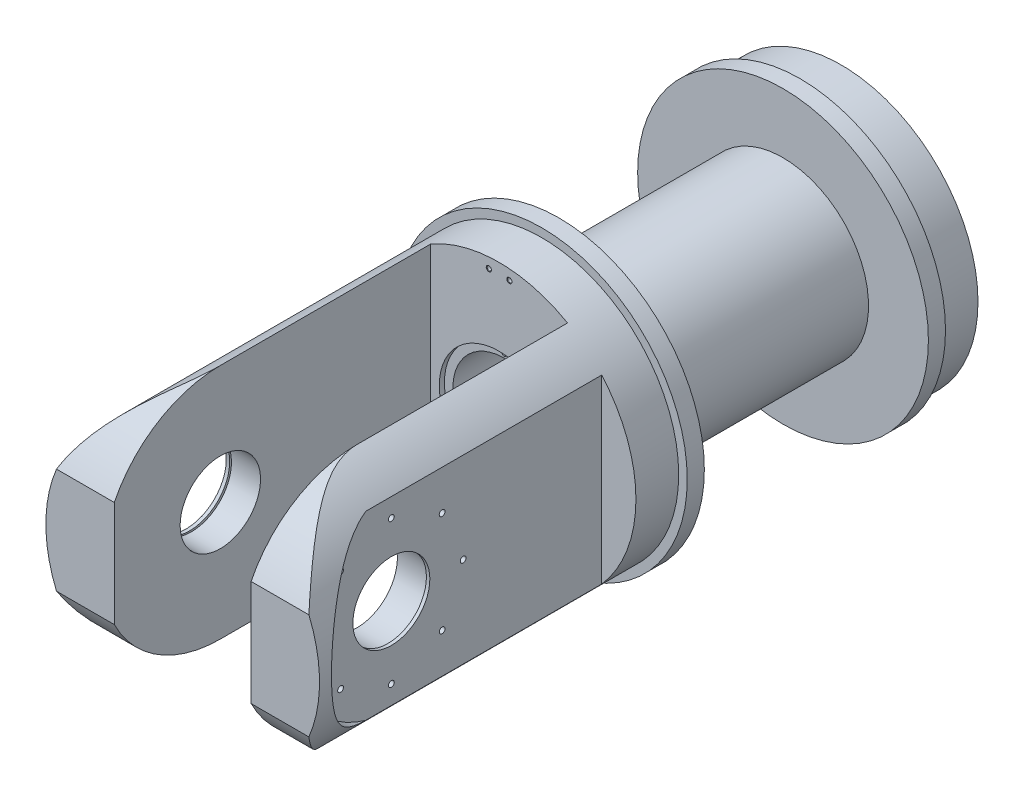
from build123d import *

# Parameters (mm, degrees)
SKETCH1_R                                   = 80
BOSS_EXTRUDE1_DEPTH                         = 24
SKETCH2_R                                   = 85
BOSS_EXTRUDE2_DEPTH                         = 151
SKETCH3_R                                   = 80
BOSS_EXTRUDE3_DEPTH                         = 25
BOSS_EXTRUDE4_DEPTH                         = 185
CUT_EXTRUDE3_DEPTH                          = 150
CUT_EXTRUDE3_DEPTH_BACK                     = 80
CUT_EXTRUDE4_DEPTH                          = 231
CUT_EXTRUDE4_DEPTH_BACK                     = 173
SKETCH14_R                                  = 23.5
CUT_EXTRUDE5_START                          = -20
CUT_EXTRUDE5_DEPTH                          = 68
CUT_EXTRUDE6_START                          = -41
CUT_EXTRUDE6_OUTLINE_R                      = 23.5
CUT_EXTRUDE6_DEPTH                          = 21
SKETCH17_R                                  = 23.5
SKETCH17_R_2                                = 22.5
BOSS_EXTRUDE6_DEPTH                         = 2
CUT_EXTRUDE7_START                          = -2
SKETCH18_R                                  = 25.000000001
CUT_EXTRUDE7_DEPTH                          = 1
F_4_0MM_DOWEL_HOLE1_D                       = 4
F_4_0MM_DOWEL_HOLE1_DEPTH                   = 2.5
F_4_0MM_DOWEL_HOLE1_CSINK_D                 = 4.05
F_4_0MM_DOWEL_HOLE1_CSINK_ANGLE             = 90
F_4_0MM_DOWEL_HOLE1_TIP                     = 1.201721238
CBORE_FOR_M3_HEX_HEAD_CAP_SCREW1_AT_2_COUNT = 2
CBORE_FOR_M3_HEX_HEAD_CAP_SCREW1_AT_2_PITCH = 32.145408319
CBORE_FOR_M3_HEX_HEAD_CAP_SCREW1_AT_3_COUNT = 2
CBORE_FOR_M3_HEX_HEAD_CAP_SCREW1_AT_3_PITCH = 59.396969982
CBORE_FOR_M3_HEX_HEAD_CAP_SCREW1_AT_4_COUNT = 2
CBORE_FOR_M3_HEX_HEAD_CAP_SCREW1_AT_4_PITCH = 77.605880731
CBORE_FOR_M3_HEX_HEAD_CAP_SCREW1_AT_5_COUNT = 2
CBORE_FOR_M3_HEX_HEAD_CAP_SCREW1_AT_5_PITCH = 84.000000256
CBORE_FOR_M3_HEX_HEAD_CAP_SCREW1_AT_6_COUNT = 2
CBORE_FOR_M3_HEX_HEAD_CAP_SCREW1_AT_6_PITCH = 77.605880869
CBORE_FOR_M3_HEX_HEAD_CAP_SCREW1_AT_7_COUNT = 2
CBORE_FOR_M3_HEX_HEAD_CAP_SCREW1_AT_7_PITCH = 59.396969619
CBORE_FOR_M3_HEX_HEAD_CAP_SCREW1_AT_8_COUNT = 2
CBORE_FOR_M3_HEX_HEAD_CAP_SCREW1_AT_8_PITCH = 32.14540818
M3_TAPPED_HOLE1_D                           = 2.5
M3_TAPPED_HOLE1_DEPTH                       = 7.748924226
M3_TAPPED_HOLE1_CSINK_D                     = 3.05
M3_TAPPED_HOLE1_CSINK_ANGLE                 = 90
M3_TAPPED_HOLE1_TIP                         = 0.751075774
CUT_EXTRUDE8_START                          = -10
SKETCH28_R                                  = 85
SKETCH28_R_2                                = 50
CUT_EXTRUDE8_DEPTH                          = 131
SKETCH29_R                                  = 30
CUT_EXTRUDE9_DEPTH                          = 180
SKETCH31_R                                  = 35
CUT_EXTRUDE10_DEPTH                         = 3
CUT_EXTRUDE11_DEPTH                         = 5
M3_TAPPED_HOLE2_D                           = 2.5
M3_TAPPED_HOLE2_DEPTH                       = 7.748924226
M3_TAPPED_HOLE2_CSINK_D                     = 3.05
M3_TAPPED_HOLE2_CSINK_ANGLE                 = 90
M3_TAPPED_HOLE2_TIP                         = 0.751075774


with BuildPart() as part:
    # Sketch1 → Boss-Extrude1 (new body)
    with BuildSketch(Plane.XY):
        Circle(SKETCH1_R)
    extrude(amount=BOSS_EXTRUDE1_DEPTH)

    # Sketch2 → Boss-Extrude2 (add)
    with BuildSketch(Plane.XY.offset(24)):
        Circle(SKETCH2_R)
    extrude(amount=BOSS_EXTRUDE2_DEPTH)

    # Sketch3 → Boss-Extrude3 (add)
    with BuildSketch(Plane.XY.offset(175)):
        Circle(SKETCH3_R)
    extrude(amount=BOSS_EXTRUDE3_DEPTH)

    # Sketch4 → Boss-Extrude4 (add)
    with BuildSketch(Plane.XY.offset(200)):
        with BuildLine():
            Line((-40, -69.282032303), (-40, -48))
            Line((-40, -48), (-40, 48))
            Line((-40, 48), (-40, 69.282032303))
            ThreePointArc((-40, 69.282032303), (-80, 0), (-40, -69.282032303))
        make_face()
        with BuildLine():
            Line((40, -48), (40, -69.282032303))
            ThreePointArc((40, -69.282032303), (69.282032303, -40), (80, 0))
            ThreePointArc((80, 0), (69.282032303, 40), (40, 69.282032303))
            Line((40, 69.282032303), (40, 48))
            Line((40, 48), (40, -48))
        make_face()
    extrude(amount=BOSS_EXTRUDE4_DEPTH)

    # Sketch11 → Cut-Extrude3 (cut, two sides: drawn at the far end of the back side and taken through both)
    with BuildSketch(Plane.ZY.offset(-40).offset(-CUT_EXTRUDE3_DEPTH_BACK)):
        with BuildLine():
            Line((385, 69.282032303), (385, 30.914695535))
            ThreePointArc((385, 30.914695535), (359.455097678, 58.913022782), (323, 69.28))
            Line((323, 69.28), (347.386758864, 93.666758864))
            Line((347.386758864, 93.666758864), (385, 69.282032303))
        make_face()
        with BuildLine():
            Line((385, -69.282032303), (385, -30.914695535))
            ThreePointArc((385, -30.914695535), (359.455097678, -58.913022782), (323, -69.28))
            Line((323, -69.28), (355.703900089, -94.603073538))
            Line((355.703900089, -94.603073538), (385, -69.282032303))
        make_face()
    extrude(amount=CUT_EXTRUDE3_DEPTH + CUT_EXTRUDE3_DEPTH_BACK, mode=Mode.SUBTRACT)

    # Sketch14 → Cut-Extrude4 (cut, two sides: drawn at the far end of the back side and taken through both)
    with BuildSketch(Plane(origin=(-40, 0, 0), x_dir=(0, 0, -1), z_dir=(1, 0, 0)).offset(-CUT_EXTRUDE4_DEPTH_BACK)):
        with Locations(Location((-323, 0, 0), (0, 0, 180))):
            Circle(SKETCH14_R)
    extrude(amount=CUT_EXTRUDE4_DEPTH + CUT_EXTRUDE4_DEPTH_BACK, mode=Mode.SUBTRACT)

    # Sketch14<3> → Cut-Extrude5 (cut)
    with BuildSketch(Plane(origin=(-40, 0, 0), x_dir=(0, 0, -1), z_dir=(1, 0, 0)).offset(CUT_EXTRUDE5_START)):
        with BuildLine():
            Line((-323, -55), (-200, -55))
            Line((-200, -55), (-200, 55))
            Line((-200, 55), (-323, 55))
            ThreePointArc((-323, 55), (-378, 0), (-323, -55))
        make_face()
    extrude(amount=-CUT_EXTRUDE5_DEPTH, mode=Mode.SUBTRACT)

    # Cut-Extrude6: read off the stored shape, not the designer's step
    # Cut-Extrude6 outline → Cut-Extrude6 (cut)
    with BuildSketch(Plane.ZY.offset(-40).offset(CUT_EXTRUDE6_START)):
        with BuildLine():
            ThreePointArc((338, -52.915026221), (378, 0), (338, 52.915026221))
            Line((338, 52.915026221), (200, 52.915026221))
            Line((200, 52.915026221), (200, -52.915026221))
            Line((200, -52.915026221), (338, -52.915026221))
        make_face()
        with Locations((323, 0)):
            Circle(CUT_EXTRUDE6_OUTLINE_R, mode=Mode.SUBTRACT)
    extrude(amount=CUT_EXTRUDE6_DEPTH, mode=Mode.SUBTRACT)

    # Sketch17 → Boss-Extrude6 (add)
    with BuildSketch(Plane(origin=(60, 0, 0), x_dir=(0, 0, -1), z_dir=(1, 0, 0))):
        with Locations(Location((-323, 0, 0), (0, 0, 180))):
            Circle(SKETCH17_R)
        with Locations((-323, 0)):
            Circle(SKETCH17_R_2, mode=Mode.SUBTRACT)
    extrude(amount=-BOSS_EXTRUDE6_DEPTH)

    # Sketch18 → Cut-Extrude7 (cut)
    with BuildSketch(Plane.ZY.offset(60).offset(CUT_EXTRUDE7_START)):
        with Locations((322.999999999, 0)):
            Circle(SKETCH18_R)
    extrude(amount=-CUT_EXTRUDE7_DEPTH, mode=Mode.SUBTRACT)

    # Ø4.0mm Dowel Hole1
    with Locations(Plane(origin=(0, 0, 0), x_dir=(-1, 0, 0), z_dir=(0, 0, -1))):
        with Locations((7.125, 12.340862004), (-14.25, 0), (7.125, -12.340862004)):
            CounterSinkHole(F_4_0MM_DOWEL_HOLE1_D / 2, F_4_0MM_DOWEL_HOLE1_CSINK_D / 2, depth=F_4_0MM_DOWEL_HOLE1_DEPTH, counter_sink_angle=F_4_0MM_DOWEL_HOLE1_CSINK_ANGLE)
            with Locations((0, 0, -(F_4_0MM_DOWEL_HOLE1_DEPTH + F_4_0MM_DOWEL_HOLE1_TIP / 2))):  # 118° drill point
                Cone(0, F_4_0MM_DOWEL_HOLE1_D / 2, F_4_0MM_DOWEL_HOLE1_TIP, mode=Mode.SUBTRACT)

    # Sketch24 → CBORE for M3 Hex Head Cap Screw1 (revolve, cut)
    with BuildSketch(Plane(origin=(40, 29.698484809, 352.698485171), x_dir=(0, 0, 1), z_dir=(0, 1, 0))):
        Polygon((0, 0), (0, 100), (1.7, 98.978536948), (1.7, 2), (4.6755, 2), (4.6755, 0.025), (4.7005, 0), align=None)
    cbore_for_m3_hex_head_cap_screw1 = revolve(axis=Axis((33.65, 29.698484809, 352.698485171), (1, 0, 0)), mode=Mode.SUBTRACT)

    # CBORE for M3 Hex Head Cap Screw1 at 2: CBORE for M3 Hex Head Cap Screw1 ×2
    with Locations(*[Vector(0, 0.38268343238663344, -0.9238795325023631) * (i * CBORE_FOR_M3_HEX_HEAD_CAP_SCREW1_AT_2_PITCH) for i in range(1, CBORE_FOR_M3_HEX_HEAD_CAP_SCREW1_AT_2_COUNT)]):
        add(cbore_for_m3_hex_head_cap_screw1, mode=Mode.SUBTRACT)

    # CBORE for M3 Hex Head Cap Screw1 at 3: CBORE for M3 Hex Head Cap Screw1 ×2
    with Locations(*[(0, 0, -i * CBORE_FOR_M3_HEX_HEAD_CAP_SCREW1_AT_3_PITCH) for i in range(1, CBORE_FOR_M3_HEX_HEAD_CAP_SCREW1_AT_3_COUNT)]):
        add(cbore_for_m3_hex_head_cap_screw1, mode=Mode.SUBTRACT)

    # CBORE for M3 Hex Head Cap Screw1 at 4: CBORE for M3 Hex Head Cap Screw1 ×2
    with Locations(*[Vector(0, -0.38268343234354807, -0.9238795325202097) * (i * CBORE_FOR_M3_HEX_HEAD_CAP_SCREW1_AT_4_PITCH) for i in range(1, CBORE_FOR_M3_HEX_HEAD_CAP_SCREW1_AT_4_COUNT)]):
        add(cbore_for_m3_hex_head_cap_screw1, mode=Mode.SUBTRACT)

    # CBORE for M3 Hex Head Cap Screw1 at 5: CBORE for M3 Hex Head Cap Screw1 ×2
    with Locations(*[Vector(0, -0.7071067790185388, -0.7071067833545563) * (i * CBORE_FOR_M3_HEX_HEAD_CAP_SCREW1_AT_5_PITCH) for i in range(1, CBORE_FOR_M3_HEX_HEAD_CAP_SCREW1_AT_5_COUNT)]):
        add(cbore_for_m3_hex_head_cap_screw1, mode=Mode.SUBTRACT)

    # CBORE for M3 Hex Head Cap Screw1 at 6: CBORE for M3 Hex Head Cap Screw1 ×2
    with Locations(*[Vector(0, -0.9238795308552009, -0.3826834363632349) * (i * CBORE_FOR_M3_HEX_HEAD_CAP_SCREW1_AT_6_PITCH) for i in range(1, CBORE_FOR_M3_HEX_HEAD_CAP_SCREW1_AT_6_COUNT)]):
        add(cbore_for_m3_hex_head_cap_screw1, mode=Mode.SUBTRACT)

    # CBORE for M3 Hex Head Cap Screw1 at 7: CBORE for M3 Hex Head Cap Screw1 ×2
    with Locations(*[(0, -i * CBORE_FOR_M3_HEX_HEAD_CAP_SCREW1_AT_7_PITCH, 0) for i in range(1, CBORE_FOR_M3_HEX_HEAD_CAP_SCREW1_AT_7_COUNT)]):
        add(cbore_for_m3_hex_head_cap_screw1, mode=Mode.SUBTRACT)

    # CBORE for M3 Hex Head Cap Screw1 at 8: CBORE for M3 Hex Head Cap Screw1 ×2
    with Locations(*[Vector(0, -0.923879536498383, 0.38268342273938816) * (i * CBORE_FOR_M3_HEX_HEAD_CAP_SCREW1_AT_8_PITCH) for i in range(1, CBORE_FOR_M3_HEX_HEAD_CAP_SCREW1_AT_8_COUNT)]):
        add(cbore_for_m3_hex_head_cap_screw1, mode=Mode.SUBTRACT)

    # M3 Tapped Hole1
    with Locations(Plane.XY.offset(200)):
        with Locations((6.003975117, 73.782027346), (-5.995716225, 73.782027346), (-5.995716225, -73.782027346), (6.003975117, -73.782027346)):
            CounterSinkHole(M3_TAPPED_HOLE1_D / 2, M3_TAPPED_HOLE1_CSINK_D / 2, depth=M3_TAPPED_HOLE1_DEPTH, counter_sink_angle=M3_TAPPED_HOLE1_CSINK_ANGLE)
            with Locations((0, 0, -(M3_TAPPED_HOLE1_DEPTH + M3_TAPPED_HOLE1_TIP / 2))):  # 118° drill point
                Cone(0, M3_TAPPED_HOLE1_D / 2, M3_TAPPED_HOLE1_TIP, mode=Mode.SUBTRACT)

    # Sketch28 → Cut-Extrude8 (cut)
    with BuildSketch(Plane(origin=(0, 0, 24), x_dir=(-1, 0, 0), z_dir=(0, 0, -1)).offset(CUT_EXTRUDE8_START)):
        Circle(SKETCH28_R)
        Circle(SKETCH28_R_2, mode=Mode.SUBTRACT)
    extrude(amount=-CUT_EXTRUDE8_DEPTH, mode=Mode.SUBTRACT)

    # Sketch29 → Cut-Extrude9 (cut)
    with BuildSketch(Plane.XY.offset(200)):
        Circle(SKETCH29_R)
    extrude(amount=-CUT_EXTRUDE9_DEPTH, mode=Mode.SUBTRACT)

    # Sketch31 → Cut-Extrude10 (cut)
    with BuildSketch(Plane.XY.offset(200)):
        Circle(SKETCH31_R)
    extrude(amount=-CUT_EXTRUDE10_DEPTH, mode=Mode.SUBTRACT)

    # Sketch33 → Cut-Extrude11 (cut)
    with BuildSketch(Plane.XY.offset(200)):
        with BuildLine():
            Line((-6, -42.074338973), (-6, -33.813406028))
            ThreePointArc((-6, -33.813406028), (0, -34.341613637), (6, -33.813406028))
            Line((6, -33.813406028), (6, -42.074338973))
            ThreePointArc((6, -42.074338973), (0, -42.5), (-6, -42.074338973))
        make_face()
    extrude(amount=-CUT_EXTRUDE11_DEPTH, mode=Mode.SUBTRACT)

    # M3 Tapped Hole2
    with Locations(Plane.XY.offset(197)):
        with Locations((0, -32.463995233), (0, 32.399564822)):
            CounterSinkHole(M3_TAPPED_HOLE2_D / 2, M3_TAPPED_HOLE2_CSINK_D / 2, depth=M3_TAPPED_HOLE2_DEPTH, counter_sink_angle=M3_TAPPED_HOLE2_CSINK_ANGLE)
            with Locations((0, 0, -(M3_TAPPED_HOLE2_DEPTH + M3_TAPPED_HOLE2_TIP / 2))):  # 118° drill point
                Cone(0, M3_TAPPED_HOLE2_D / 2, M3_TAPPED_HOLE2_TIP, mode=Mode.SUBTRACT)


solid = part.part
